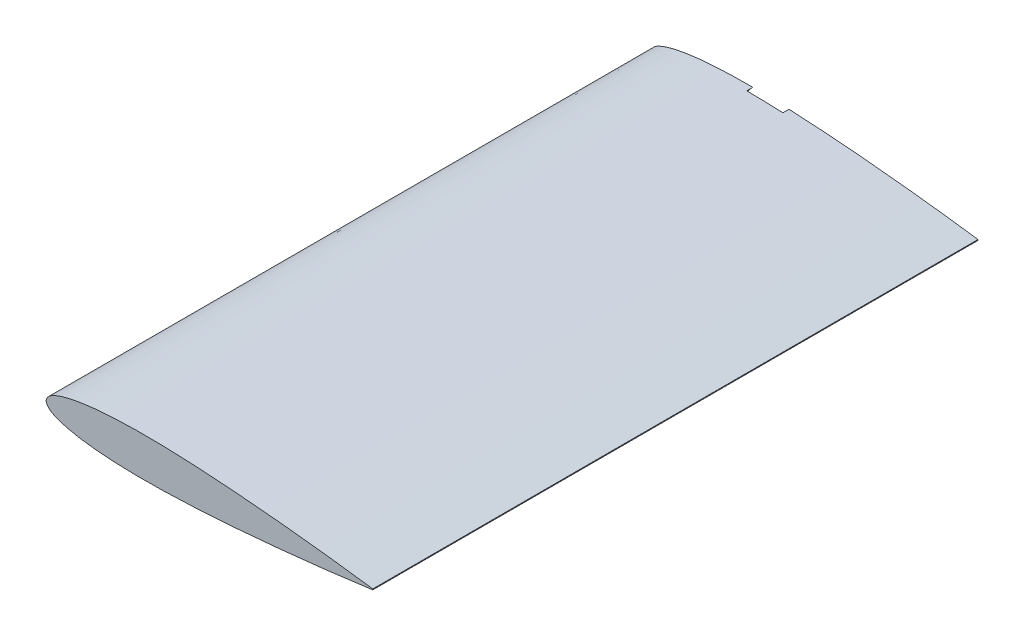
from build123d import *

# Parameters (mm, degrees)
BOSS_EXTRUDE1_DEPTH = 100
SHELL1_START        = 2
SHELL1_DEPTH        = 97
BOSS_EXTRUDE2_REACH = 115.695
SKETCH4_R           = 4.35
CUT_EXTRUDE1_DEPTH  = 1
SKETCH5_R           = 1
CUT_EXTRUDE2_DEPTH  = 2


# Read off the part's stored shape, not the designer's step: Shell1
with BuildPart() as part:
    # Sketch1 → Boss-Extrude1 (new body)
    with BuildSketch(Plane.XY):
        with BuildLine():
            add(Edge.make_bspline(
                [(0, 0), (0.096672882, -0.462214069), (0.351976089, -0.780117648), (0.675, -1.02276)],
                knots=[0, 0, 0, 0, 0.022277188, 0.022277188, 0.022277188, 0.022277188], degree=3))
            Line((0.675, -1.02276), (0.675, 1.02276))
            add(Edge.make_bspline(
                [(0, 0), (0.096672882, 0.462214069), (0.351976089, 0.780117648), (0.675, 1.02276)],
                knots=[0, 0, 0, 0, 0.022277188, 0.022277188, 0.022277188, 0.022277188], degree=3))
        make_face()
        with BuildLine():
            Line((0.675, 1.02276), (0.675, -1.02276))
            add(Edge.make_bspline(
                [(0.675, -1.02276), (0.880408359, -1.177054359), (1.113200179, -1.30091618), (1.35, -1.4121)],
                knots=[0.022277188, 0.022277188, 0.022277188, 0.022277188, 0.036443076, 0.036443076, 0.036443076, 0.036443076], degree=3))
            Line((1.35, -1.4121), (1.35, 1.4121))
            add(Edge.make_bspline(
                [(0.675, 1.02276), (0.880408359, 1.177054359), (1.113200179, 1.30091618), (1.35, 1.4121)],
                knots=[0.022277188, 0.022277188, 0.022277188, 0.022277188, 0.036443076, 0.036443076, 0.036443076, 0.036443076], degree=3))
        make_face()
        with BuildLine():
            Line((1.35, 1.4121), (1.35, -1.4121))
            add(Edge.make_bspline(
                [(1.35, -1.4121), (1.788288243, -1.617887999), (2.240306933, -1.780244213), (2.7, -1.9197)],
                knots=[0.036443076, 0.036443076, 0.036443076, 0.036443076, 0.062662446, 0.062662446, 0.062662446, 0.062662446], degree=3))
            Line((2.7, -1.9197), (2.7, 1.9197))
            add(Edge.make_bspline(
                [(1.35, 1.4121), (1.788288243, 1.617887999), (2.240306933, 1.780244213), (2.7, 1.9197)],
                knots=[0.036443076, 0.036443076, 0.036443076, 0.036443076, 0.062662446, 0.062662446, 0.062662446, 0.062662446], degree=3))
        make_face()
        with BuildLine():
            Line((2.7, 1.9197), (2.7, -1.9197))
            add(Edge.make_bspline(
                [(2.7, -1.9197), (3.144372368, -2.05450799), (3.595916093, -2.16791657), (4.05, -2.268)],
                knots=[0.062662446, 0.062662446, 0.062662446, 0.062662446, 0.088007975, 0.088007975, 0.088007975, 0.088007975], degree=3))
            Line((4.05, -2.268), (4.05, 2.268))
            add(Edge.make_bspline(
                [(2.7, 1.9197), (3.144372368, 2.05450799), (3.595916093, 2.16791657), (4.05, 2.268)],
                knots=[0.062662446, 0.062662446, 0.062662446, 0.062662446, 0.088007975, 0.088007975, 0.088007975, 0.088007975], degree=3))
        make_face()
        with BuildLine():
            Line((4.05, 2.268), (4.05, -2.268))
            add(Edge.make_bspline(
                [(4.05, -2.268), (4.497816748, -2.366702102), (4.948104044, -2.452444337), (5.4, -2.52882)],
                knots=[0.088007975, 0.088007975, 0.088007975, 0.088007975, 0.113003691, 0.113003691, 0.113003691, 0.113003691], degree=3))
            Line((5.4, -2.52882), (5.4, 2.52882))
            add(Edge.make_bspline(
                [(4.05, 2.268), (4.497816748, 2.366702102), (4.948104044, 2.452444337), (5.4, 2.52882)],
                knots=[0.088007975, 0.088007975, 0.088007975, 0.088007975, 0.113003691, 0.113003691, 0.113003691, 0.113003691], degree=3))
        make_face()
        with BuildLine():
            Line((5.4, 2.52882), (5.4, -2.52882))
            add(Edge.make_bspline(
                [(5.4, -2.52882), (6.295126323, -2.680106741), (7.196564485, -2.794642208), (8.1, -2.8863)],
                knots=[0.113003691, 0.113003691, 0.113003691, 0.113003691, 0.162515802, 0.162515802, 0.162515802, 0.162515802], degree=3))
            Line((8.1, -2.8863), (8.1, 2.8863))
            add(Edge.make_bspline(
                [(5.4, 2.52882), (6.295126323, 2.680106741), (7.196564485, 2.794642208), (8.1, 2.8863)],
                knots=[0.113003691, 0.113003691, 0.113003691, 0.113003691, 0.162515802, 0.162515802, 0.162515802, 0.162515802], degree=3))
        make_face()
        with BuildLine():
            Line((8.1, 2.8863), (8.1, -2.8863))
            add(Edge.make_bspline(
                [(8.1, -2.8863), (8.998367894, -2.977443658), (9.898710795, -3.045965575), (10.8, -3.09798)],
                knots=[0.162515802, 0.162515802, 0.162515802, 0.162515802, 0.211750186, 0.211750186, 0.211750186, 0.211750186], degree=3))
            Line((10.8, -3.09798), (10.8, 3.09798))
            add(Edge.make_bspline(
                [(8.1, 2.8863), (8.998367894, 2.977443658), (9.898710795, 3.045965575), (10.8, 3.09798)],
                knots=[0.162515802, 0.162515802, 0.162515802, 0.162515802, 0.211750186, 0.211750186, 0.211750186, 0.211750186], degree=3))
        make_face()
        with BuildLine():
            Line((10.8, 3.09798), (10.8, -3.09798))
            add(Edge.make_bspline(
                [(10.8, -3.09798), (11.69927955, -3.149878446), (12.599501187, -3.185342932), (13.5, -3.20814)],
                knots=[0.211750186, 0.211750186, 0.211750186, 0.211750186, 0.26087479, 0.26087479, 0.26087479, 0.26087479], degree=3))
            Line((13.5, -3.20814), (13.5, 3.20814))
            add(Edge.make_bspline(
                [(10.8, 3.09798), (11.69927955, 3.149878446), (12.599501187, 3.185342932), (13.5, 3.20814)],
                knots=[0.211750186, 0.211750186, 0.211750186, 0.211750186, 0.26087479, 0.26087479, 0.26087479, 0.26087479], degree=3))
        make_face()
        with BuildLine():
            Line((13.5, 3.20814), (13.5, -3.20814))
            add(Edge.make_bspline(
                [(13.5, -3.20814), (14.399817201, -3.230919812), (15.299911159, -3.241051374), (16.2, -3.24108)],
                knots=[0.26087479, 0.26087479, 0.26087479, 0.26087479, 0.30996221, 0.30996221, 0.30996221, 0.30996221], degree=3))
            Line((16.2, -3.24108), (16.2, 3.24108))
            add(Edge.make_bspline(
                [(13.5, 3.20814), (14.399817201, 3.230919812), (15.299911159, 3.241051374), (16.2, 3.24108)],
                knots=[0.26087479, 0.26087479, 0.26087479, 0.26087479, 0.30996221, 0.30996221, 0.30996221, 0.30996221], degree=3))
        make_face()
        with BuildLine():
            Line((16.2, 3.24108), (16.2, -3.24108))
            add(Edge.make_bspline(
                [(16.2, -3.24108), (18.000400111, -3.241137259), (19.800779751, -3.200772785), (21.6, -3.13362)],
                knots=[0.30996221, 0.30996221, 0.30996221, 0.30996221, 0.40814918, 0.40814918, 0.40814918, 0.40814918], degree=3))
            Line((21.6, -3.13362), (21.6, 3.13362))
            add(Edge.make_bspline(
                [(16.2, 3.24108), (18.000400111, 3.241137259), (19.800779751, 3.200772785), (21.6, 3.13362)],
                knots=[0.30996221, 0.30996221, 0.30996221, 0.30996221, 0.40814918, 0.40814918, 0.40814918, 0.40814918], degree=3))
        make_face()
        with BuildLine():
            Line((21.6, 3.13362), (21.6, -3.13362))
            add(Edge.make_bspline(
                [(21.6, -3.13362), (23.40119285, -3.066393591), (25.201223764, -2.972320097), (27, -2.85876)],
                knots=[0.40814918, 0.40814918, 0.40814918, 0.40814918, 0.506443799, 0.506443799, 0.506443799, 0.506443799], degree=3))
            Line((27, -2.85876), (27, 2.85876))
            add(Edge.make_bspline(
                [(21.6, 3.13362), (23.40119285, 3.066393591), (25.201223764, 2.972320097), (27, 2.85876)],
                knots=[0.40814918, 0.40814918, 0.40814918, 0.40814918, 0.506443799, 0.506443799, 0.506443799, 0.506443799], degree=3))
        make_face()
        with BuildLine():
            Line((27, 2.85876), (27, -2.85876))
            add(Edge.make_bspline(
                [(27, -2.85876), (28.801243981, -2.745044109), (30.601229838, -2.611788111), (32.4, -2.46402)],
                knots=[0.506443799, 0.506443799, 0.506443799, 0.506443799, 0.604873268, 0.604873268, 0.604873268, 0.604873268], degree=3))
            Line((32.4, -2.46402), (32.4, 2.46402))
            add(Edge.make_bspline(
                [(27, 2.85876), (28.801243981, 2.745044109), (30.601229838, 2.611788111), (32.4, 2.46402)],
                knots=[0.506443799, 0.506443799, 0.506443799, 0.506443799, 0.604873268, 0.604873268, 0.604873268, 0.604873268], degree=3))
        make_face()
        with BuildLine():
            Line((32.4, 2.46402), (32.4, -2.46402))
            add(Edge.make_bspline(
                [(32.4, -2.46402), (34.201218281, -2.316050778), (36.001217555, -2.153529914), (37.8, -1.97856)],
                knots=[0.604873268, 0.604873268, 0.604873268, 0.604873268, 0.7034367, 0.7034367, 0.7034367, 0.7034367], degree=3))
            Line((37.8, -1.97856), (37.8, 1.97856))
            add(Edge.make_bspline(
                [(32.4, 2.46402), (34.201218281, 2.316050778), (36.001217555, 2.153529914), (37.8, 1.97856)],
                knots=[0.604873268, 0.604873268, 0.604873268, 0.604873268, 0.7034367, 0.7034367, 0.7034367, 0.7034367], degree=3))
        make_face()
        with BuildLine():
            Line((37.8, 1.97856), (37.8, -1.97856))
            add(Edge.make_bspline(
                [(37.8, -1.97856), (39.601238547, -1.803351177), (41.401256939, -1.615659284), (43.2, -1.41642)],
                knots=[0.7034367, 0.7034367, 0.7034367, 0.7034367, 0.802134713, 0.802134713, 0.802134713, 0.802134713], degree=3))
            Line((43.2, -1.41642), (43.2, 1.41642))
            add(Edge.make_bspline(
                [(37.8, 1.97856), (39.601238547, 1.803351177), (41.401256939, 1.615659284), (43.2, 1.41642)],
                knots=[0.7034367, 0.7034367, 0.7034367, 0.7034367, 0.802134713, 0.802134713, 0.802134713, 0.802134713], degree=3))
        make_face()
        with BuildLine():
            Line((43.2, 1.41642), (43.2, -1.41642))
            add(Edge.make_bspline(
                [(43.2, -1.41642), (45.001383122, -1.216888288), (46.801487166, -1.005775264), (48.6, -0.78192)],
                knots=[0.802134713, 0.802134713, 0.802134713, 0.802134713, 0.900977587, 0.900977587, 0.900977587, 0.900977587], degree=3))
            Line((48.6, -0.78192), (48.6, 0.78192))
            add(Edge.make_bspline(
                [(43.2, 1.41642), (45.001383122, 1.216888288), (46.801487166, 1.005775264), (48.6, 0.78192)],
                knots=[0.802134713, 0.802134713, 0.802134713, 0.802134713, 0.900977587, 0.900977587, 0.900977587, 0.900977587], degree=3))
        make_face()
        with BuildLine():
            Line((48.6, 0.78192), (48.6, -0.78192))
            add(Edge.make_bspline(
                [(48.6, -0.78192), (49.500421632, -0.669847337), (50.40044443, -0.554580854), (51.3, -0.43578)],
                knots=[0.900977587, 0.900977587, 0.900977587, 0.900977587, 0.950463062, 0.950463062, 0.950463062, 0.950463062], degree=3))
            Line((51.3, -0.43578), (51.3, 0.43578))
            add(Edge.make_bspline(
                [(48.6, 0.78192), (49.500421632, 0.669847337), (50.40044443, 0.554580854), (51.3, 0.43578)],
                knots=[0.900977587, 0.900977587, 0.900977587, 0.900977587, 0.950463062, 0.950463062, 0.950463062, 0.950463062], degree=3))
        make_face()
        with BuildLine():
            Line((51.3, 0.43578), (51.3, -0.43578))
            add(Edge.make_bspline(
                [(51.3, -0.43578), (52.20049107, -0.316855598), (53.100513939, -0.194389469), (54, -0.06804)],
                knots=[0.950463062, 0.950463062, 0.950463062, 0.950463062, 1, 1, 1, 1], degree=3))
            Line((54, -0.06804), (54, 0.06804))
            add(Edge.make_bspline(
                [(51.3, 0.43578), (52.20049107, 0.316855598), (53.100513939, 0.194389469), (54, 0.06804)],
                knots=[0.950463062, 0.950463062, 0.950463062, 0.950463062, 1, 1, 1, 1], degree=3))
        make_face()
    extrude(amount=BOSS_EXTRUDE1_DEPTH)

    # Shell1 outline → Shell1 (cut)
    with BuildSketch(Plane.XY.offset(SHELL1_START)):
        with BuildLine():
            add(Edge.make_bspline(
                [(1.058623393, -1.49e-07), (1.075119993, 0.026392925), (1.093403251, 0.052230133), (1.113862389, 0.078124886), (1.136946081, 0.104517594), (1.163096513, 0.131656613), (1.192683699, 0.159615721), (1.2259605, 0.188343386), (1.263051431, 0.217722124), (1.303973016, 0.247616825), (1.348668278, 0.277901714), (1.397031118, 0.30846942), (1.448906083, 0.339235108), (1.504083532, 0.370146527), (1.57297173, 0.406831513), (1.583668628, 0.412477493), (1.594467107, 0.418127689), (1.60536592, 0.423782035), (1.616363814, 0.429440498), (1.627459529, 0.435103082), (1.638651799, 0.440769829), (1.649939349, 0.446440815), (1.661320899, 0.452116152), (1.672795161, 0.457795992), (1.68436084, 0.463480518), (1.696016635, 0.469169954), (1.707761237, 0.474864556), (1.725509377, 0.483414653), (1.73144132, 0.48626322), (1.73745685, 0.489142444), (1.743175633, 0.491872725), (1.749976725, 0.495105316), (1.754281882, 0.497152181), (1.763030108, 0.501284372), (1.765986685, 0.502681966), (1.774608877, 0.506735407), (1.779348443, 0.508957787), (1.785937076, 0.512039473), (1.791938156, 0.514837955), (1.7980622, 0.517686104), (1.810295561, 0.523359768), (1.816416468, 0.526190702), (1.822541603, 0.529015756), (1.828670967, 0.53183495), (1.834804563, 0.5346483), (1.840942391, 0.537455826), (1.847084454, 0.540257546), (1.853230753, 0.543053477), (1.85938129, 0.545843637), (1.865536067, 0.548628046), (1.871695086, 0.551406721), (1.877858347, 0.554179681), (1.884025853, 0.556946943), (1.914884615, 0.570754857), (1.939639723, 0.581710358), (1.964462932, 0.59257616), (1.989354244, 0.603353395), (2.014313664, 0.614043193), (2.039341193, 0.624646686), (2.064436835, 0.635165005), (2.089600591, 0.64559928), (2.114832466, 0.655950643), (2.140132462, 0.666220225), (2.165500582, 0.676409157), (2.190936828, 0.68651857), (2.216441204, 0.696549596), (2.29315873, 0.726410903), (2.34457574, 0.746009416), (2.396264015, 0.765307729), (2.448222652, 0.784314723), (2.500450577, 0.803039327), (2.55294654, 0.821490521), (2.605709121, 0.839677337), (2.658736724, 0.857608859), (2.712027583, 0.875294219), (2.765579755, 0.892742604), (2.819391129, 0.90996325), (2.873459416, 0.926965442), (2.927782157, 0.943758521), (3.03693128, 0.976945228), (3.091732893, 0.993331834), (3.146524962, 1.009445692), (3.201755781, 1.025425728), (3.256871468, 1.041111135), (3.312231726, 1.056614371), (3.36785696, 1.071946468), (3.423478822, 1.087032126), (3.47925215, 1.101922629), (3.535305819, 1.11666154), (3.59133897, 1.131163939), (3.647600482, 1.14550933), (3.70396528, 1.159665426), (3.788714108, 1.180637312), (3.816996256, 1.187583891), (3.845310574, 1.194486963), (3.873656697, 1.201347074), (3.902034256, 1.208164767), (3.930442886, 1.214940587), (3.958882219, 1.221675077), (3.987351888, 1.228368781), (4.015851527, 1.235022244), (4.044380768, 1.24163601), (4.072939244, 1.248210623), (4.101526589, 1.254746626), (4.130142435, 1.261244565), (4.187430397, 1.274165401), (4.216105022, 1.280588761), (4.244798484, 1.286973998), (4.27351158, 1.293318736), (4.302335934, 1.299649619), (4.331065909, 1.305917526), (4.359792173, 1.312141863), (4.38864479, 1.318354481), (4.417472305, 1.324521299), (4.446231056, 1.330631326), (4.47512956, 1.336733199), (4.503964458, 1.342780781), (4.532841629, 1.348798319), (4.619507402, 1.366740803), (4.677346297, 1.378559162), (4.735246406, 1.390236382), (4.793207226, 1.401774623), (4.85122826, 1.413176042), (4.909309005, 1.424442797), (4.967448962, 1.435577048), (5.02564763, 1.446580951), (5.083904509, 1.457456666), (5.142219099, 1.468206351), (5.200590899, 1.478832163), (5.259019409, 1.489336262), (5.317504129, 1.499720806), (5.434584986, 1.5202551), (5.49318391, 1.530405039), (5.551830738, 1.540441385), (5.610482155, 1.550345725), (5.669497507, 1.560213093), (5.727908623, 1.569839604), (5.786895052, 1.579452162), (5.845910272, 1.588959308), (5.904455383, 1.598259955), (5.963671326, 1.607568579), (6.02248308, 1.616691129), (6.081520377, 1.62574114), (6.140542117, 1.634677268), (6.317727829, 1.661176683), (6.435987683, 1.678426732), (6.554380721, 1.695269327), (6.672904067, 1.711713264), (6.791554838, 1.727767356), (6.910330136, 1.743440436), (7.029227055, 1.758741359), (7.148242674, 1.773678994), (7.267374065, 1.788262234), (7.386618285, 1.802499989), (7.505972383, 1.816401189), (7.625433395, 1.829974783), (7.744998345, 1.84322974), (7.924497198, 1.862647701), (7.984355312, 1.869043157), (8.044233573, 1.875360317), (8.104171789, 1.881610459), (8.164030483, 1.88776925), (8.22404363, 1.893871722), (8.284080406, 1.899906488), (8.343982991, 1.905850505), (8.403961565, 1.911727738), (8.46406653, 1.917548241), (8.524015342, 1.923278622), (8.584085277, 1.928950256), (8.644132594, 1.934548335), (8.764264457, 1.945606953), (8.824343709, 1.951066953), (8.884436194, 1.956458155), (8.944541827, 1.961781067), (9.004660521, 1.9670362), (9.064792191, 1.972224064), (9.124936751, 1.977345168), (9.185094114, 1.982400022), (9.245264196, 1.987389137), (9.305446909, 1.992313022), (9.365642168, 1.997172187), (9.425849886, 2.001967142), (9.486069979, 2.006698396), (9.66676712, 2.020702588), (9.787283846, 2.029786311), (9.907832434, 2.03861941), (10.028469135, 2.047212429), (10.14910818, 2.055560523), (10.269796661, 2.063671854), (10.390573439, 2.071555339), (10.511376429, 2.079209829), (10.632176506, 2.08663528), (10.753057648, 2.09384268), (10.87403846, 2.100840591), (10.994966282, 2.107621428), (11.115957702, 2.114191959), (11.357990321, 2.126916423), (11.479036518, 2.133070315), (11.600112134, 2.139018434), (11.721216704, 2.144763347), (11.84234976, 2.15030762), (11.963510835, 2.155653819), (12.084699462, 2.160804511), (12.205915176, 2.165762263), (12.327157507, 2.170529641), (12.448425991, 2.175109212), (12.56972016, 2.179503542), (12.691039546, 2.183715198), (12.812383684, 2.187746747), (13.17648895, 2.199308769), (13.419336971, 2.206307783), (13.662151809, 2.21261052), (13.90555308, 2.218256823), (14.14802945, 2.223266915), (14.39159215, 2.227588019), (14.634723768, 2.231322043), (14.877682103, 2.234445049), (15.121352512, 2.236930967), (15.364440983, 2.238874391), (15.607982066, 2.240223424), (15.851391798, 2.241021109), (16.094925031, 2.241277984), (16.58203171, 2.240730609), (16.825618123, 2.239926008), (17.069236802, 2.238599939), (17.312886938, 2.236761851), (17.556567721, 2.234421191), (17.800278342, 2.231587406), (18.044017993, 2.228269943), (18.287785864, 2.224478249), (18.531581147, 2.220221773), (18.775403033, 2.215509961), (19.019250713, 2.210352261), (19.263123377, 2.20475812), (19.507020217, 2.198736985), (19.994860631, 2.185859623), (20.238805473, 2.179004782), (20.482752748, 2.171729339), (20.726861332, 2.164113132), (20.970405936, 2.155940734), (21.215624607, 2.147718892), (21.457555521, 2.138675524), (21.704227807, 2.129681754), (21.946172694, 2.120119672), (22.191416211, 2.110263548), (22.435048408, 2.100072196), (22.679225264, 2.089531478), (22.923289464, 2.078661831), (23.411446293, 2.056266084), (23.655527019, 2.044740493), (23.899609988, 2.032892311), (24.143695131, 2.020726665), (24.38778238, 2.008248682), (24.631871666, 1.995463489), (24.875962921, 1.982376214), (25.120056075, 1.968991982), (25.36415106, 1.955315921), (25.608247809, 1.941353158), (25.852346251, 1.92710882), (26.096446318, 1.912588034), (26.340547942, 1.897795927), (27.072857279, 1.852621022), (27.561071121, 1.821436457), (28.049325362, 1.78925686), (28.537179213, 1.755995133), (29.026156978, 1.721960251), (29.51273273, 1.686589264), (30.003143584, 1.650914714), (30.488582438, 1.613624441), (30.979110148, 1.576117094), (31.465481489, 1.537389818), (31.954359846, 1.497981818), (32.442196855, 1.457818926), (32.9302142, 1.416882621), (33.906114424, 1.333517477), (34.394026178, 1.291086931), (34.88184581, 1.247917111), (35.36981558, 1.204027851), (35.857266495, 1.159425909), (36.34540994, 1.114091715), (36.832863233, 1.068138726), (37.320329013, 1.021443458), (37.808389315, 0.974050715), (38.295569992, 0.92614555), (38.783218731, 0.87745378), (39.27061148, 0.828182103), (39.757992592, 0.778250756), (40.48897205, 0.702403029), (40.732618716, 0.676961366), (40.97624855, 0.6513615), (41.219864801, 0.625603805), (41.463468788, 0.599688888), (41.707058929, 0.573617573), (41.950633053, 0.54739064), (42.194190769, 0.521008656), (42.437734039, 0.494472026), (42.681265487, 0.467781275), (42.924785305, 0.440937328), (43.168289057, 0.41394144), (43.411769993, 0.386794205), (43.876710356, 0.334656613), (44.098173179, 0.309693206), (44.319619193, 0.284602107), (44.541048237, 0.259382712), (44.762460148, 0.23403442), (44.983854763, 0.208556629), (45.205231918, 0.182948734), (45.426591453, 0.157210135), (45.647933203, 0.131340229), (45.869257006, 0.105338412), (46.0905627, 0.079204084), (46.311850121, 0.052936641), (46.533119106, 0.02653548), (46.754369494, 0)],
                knots=[0.009755785, 0.009755785, 0.009755785, 0.009755785, 0.009755785, 0.009755785, 0.009755785, 0.009755785, 0.009755785, 0.009755785, 0.009755785, 0.009755785, 0.009755785, 0.009755785, 0.009755785, 0.03125, 0.03125, 0.03125, 0.03125, 0.03125, 0.03125, 0.03125, 0.03125, 0.03125, 0.03125, 0.03125, 0.03125, 0.03125, 0.03515625, 0.03515625, 0.03515625, 0.03515625, 0.03515625, 0.03515625, 0.03515625, 0.03515625, 0.03515625, 0.03515625, 0.03515625, 0.03515625, 0.03515625, 0.037109375, 0.037109375, 0.037109375, 0.037109375, 0.037109375, 0.037109375, 0.037109375, 0.037109375, 0.037109375, 0.037109375, 0.037109375, 0.037109375, 0.037109375, 0.0390625, 0.0390625, 0.0390625, 0.0390625, 0.0390625, 0.0390625, 0.0390625, 0.0390625, 0.0390625, 0.0390625, 0.0390625, 0.0390625, 0.0390625, 0.046875, 0.046875, 0.046875, 0.046875, 0.046875, 0.046875, 0.046875, 0.046875, 0.046875, 0.046875, 0.046875, 0.046875, 0.046875, 0.0625, 0.0625, 0.0625, 0.0625, 0.0625, 0.0625, 0.0625, 0.0625, 0.0625, 0.0625, 0.0625, 0.0625, 0.0625, 0.078125, 0.078125, 0.078125, 0.078125, 0.078125, 0.078125, 0.078125, 0.078125, 0.078125, 0.078125, 0.078125, 0.078125, 0.078125, 0.0859375, 0.0859375, 0.0859375, 0.0859375, 0.0859375, 0.0859375, 0.0859375, 0.0859375, 0.0859375, 0.0859375, 0.0859375, 0.0859375, 0.0859375, 0.09375, 0.09375, 0.09375, 0.09375, 0.09375, 0.09375, 0.09375, 0.09375, 0.09375, 0.09375, 0.09375, 0.09375, 0.09375, 0.109375, 0.109375, 0.109375, 0.109375, 0.109375, 0.109375, 0.109375, 0.109375, 0.109375, 0.109375, 0.109375, 0.109375, 0.109375, 0.125, 0.125, 0.125, 0.125, 0.125, 0.125, 0.125, 0.125, 0.125, 0.125, 0.125, 0.125, 0.125, 0.15625, 0.15625, 0.15625, 0.15625, 0.15625, 0.15625, 0.15625, 0.15625, 0.15625, 0.15625, 0.15625, 0.15625, 0.15625, 0.171875, 0.171875, 0.171875, 0.171875, 0.171875, 0.171875, 0.171875, 0.171875, 0.171875, 0.171875, 0.171875, 0.171875, 0.171875, 0.1875, 0.1875, 0.1875, 0.1875, 0.1875, 0.1875, 0.1875, 0.1875, 0.1875, 0.1875, 0.1875, 0.1875, 0.1875, 0.21875, 0.21875, 0.21875, 0.21875, 0.21875, 0.21875, 0.21875, 0.21875, 0.21875, 0.21875, 0.21875, 0.21875, 0.21875, 0.25, 0.25, 0.25, 0.25, 0.25, 0.25, 0.25, 0.25, 0.25, 0.25, 0.25, 0.25, 0.25, 0.3125, 0.3125, 0.3125, 0.3125, 0.3125, 0.3125, 0.3125, 0.3125, 0.3125, 0.3125, 0.3125, 0.3125, 0.3125, 0.375, 0.375, 0.375, 0.375, 0.375, 0.375, 0.375, 0.375, 0.375, 0.375, 0.375, 0.375, 0.375, 0.4375, 0.4375, 0.4375, 0.4375, 0.4375, 0.4375, 0.4375, 0.4375, 0.4375, 0.4375, 0.4375, 0.4375, 0.4375, 0.5, 0.5, 0.5, 0.5, 0.5, 0.5, 0.5, 0.5, 0.5, 0.5, 0.5, 0.5, 0.5, 0.625, 0.625, 0.625, 0.625, 0.625, 0.625, 0.625, 0.625, 0.625, 0.625, 0.625, 0.625, 0.625, 0.75, 0.75, 0.75, 0.75, 0.75, 0.75, 0.75, 0.75, 0.75, 0.75, 0.75, 0.75, 0.75, 0.8125, 0.8125, 0.8125, 0.8125, 0.8125, 0.8125, 0.8125, 0.8125, 0.8125, 0.8125, 0.8125, 0.8125, 0.8125, 0.869357044, 0.869357044, 0.869357044, 0.869357044, 0.869357044, 0.869357044, 0.869357044, 0.869357044, 0.869357044, 0.869357044, 0.869357044, 0.869357044, 0.869357044, 0.869357044, 0.869357044], degree=14))
            add(Edge.make_bspline(
                [(1.058623393, -1.49e-07), (1.075119993, -0.026392925), (1.093403251, -0.052230133), (1.113862389, -0.078124886), (1.136946081, -0.104517594), (1.163096513, -0.131656613), (1.192683699, -0.159615721), (1.2259605, -0.188343386), (1.263051431, -0.217722124), (1.303973016, -0.247616825), (1.348668278, -0.277901714), (1.397031118, -0.30846942), (1.448906083, -0.339235108), (1.504083532, -0.370146527), (1.57297173, -0.406831513), (1.583668628, -0.412477493), (1.594467107, -0.418127689), (1.60536592, -0.423782035), (1.616363814, -0.429440498), (1.627459529, -0.435103082), (1.638651799, -0.440769829), (1.649939349, -0.446440815), (1.661320899, -0.452116152), (1.672795161, -0.457795992), (1.68436084, -0.463480518), (1.696016635, -0.469169954), (1.707761237, -0.474864556), (1.725509377, -0.483414653), (1.73144132, -0.48626322), (1.73745685, -0.489142444), (1.743175633, -0.491872725), (1.749976725, -0.495105316), (1.754281882, -0.497152181), (1.763030108, -0.501284372), (1.765986685, -0.502681966), (1.774608877, -0.506735407), (1.779348443, -0.508957787), (1.785937076, -0.512039473), (1.791938156, -0.514837955), (1.7980622, -0.517686104), (1.810295561, -0.523359768), (1.816416468, -0.526190702), (1.822541603, -0.529015756), (1.828670967, -0.53183495), (1.834804563, -0.5346483), (1.840942391, -0.537455826), (1.847084454, -0.540257546), (1.853230753, -0.543053477), (1.85938129, -0.545843637), (1.865536067, -0.548628046), (1.871695086, -0.551406721), (1.877858347, -0.554179681), (1.884025853, -0.556946943), (1.914884615, -0.570754857), (1.939639723, -0.581710358), (1.964462932, -0.59257616), (1.989354244, -0.603353395), (2.014313664, -0.614043193), (2.039341193, -0.624646686), (2.064436835, -0.635165005), (2.089600591, -0.64559928), (2.114832466, -0.655950643), (2.140132462, -0.666220225), (2.165500582, -0.676409157), (2.190936828, -0.68651857), (2.216441204, -0.696549596), (2.29315873, -0.726410903), (2.34457574, -0.746009416), (2.396264015, -0.765307729), (2.448222652, -0.784314723), (2.500450577, -0.803039327), (2.55294654, -0.821490521), (2.605709121, -0.839677337), (2.658736724, -0.857608859), (2.712027583, -0.875294219), (2.765579755, -0.892742604), (2.819391129, -0.90996325), (2.873459416, -0.926965442), (2.927782157, -0.943758521), (3.03693128, -0.976945228), (3.091732893, -0.993331834), (3.146524962, -1.009445692), (3.201755781, -1.025425728), (3.256871468, -1.041111135), (3.312231726, -1.056614371), (3.36785696, -1.071946468), (3.423478822, -1.087032126), (3.47925215, -1.101922629), (3.535305819, -1.11666154), (3.59133897, -1.131163939), (3.647600482, -1.14550933), (3.70396528, -1.159665426), (3.788714108, -1.180637312), (3.816996256, -1.187583891), (3.845310574, -1.194486963), (3.873656697, -1.201347074), (3.902034256, -1.208164767), (3.930442886, -1.214940587), (3.958882219, -1.221675077), (3.987351888, -1.228368781), (4.015851527, -1.235022244), (4.044380768, -1.24163601), (4.072939244, -1.248210623), (4.101526589, -1.254746626), (4.130142435, -1.261244565), (4.187430397, -1.274165401), (4.216105022, -1.280588761), (4.244798484, -1.286973998), (4.27351158, -1.293318736), (4.302335934, -1.299649619), (4.331065909, -1.305917526), (4.359792173, -1.312141863), (4.38864479, -1.318354481), (4.417472305, -1.324521299), (4.446231056, -1.330631326), (4.47512956, -1.336733199), (4.503964458, -1.342780781), (4.532841629, -1.348798319), (4.619507402, -1.366740803), (4.677346297, -1.378559162), (4.735246406, -1.390236382), (4.793207226, -1.401774623), (4.85122826, -1.413176042), (4.909309005, -1.424442797), (4.967448962, -1.435577048), (5.02564763, -1.446580951), (5.083904509, -1.457456666), (5.142219099, -1.468206351), (5.200590899, -1.478832163), (5.259019409, -1.489336262), (5.317504129, -1.499720806), (5.434584986, -1.5202551), (5.49318391, -1.530405039), (5.551830738, -1.540441385), (5.610482155, -1.550345725), (5.669497507, -1.560213093), (5.727908623, -1.569839604), (5.786895052, -1.579452162), (5.845910272, -1.588959308), (5.904455383, -1.598259955), (5.963671326, -1.607568579), (6.02248308, -1.616691129), (6.081520377, -1.62574114), (6.140542117, -1.634677268), (6.317727829, -1.661176683), (6.435987683, -1.678426732), (6.554380721, -1.695269327), (6.672904067, -1.711713264), (6.791554838, -1.727767356), (6.910330136, -1.743440436), (7.029227055, -1.758741359), (7.148242674, -1.773678994), (7.267374065, -1.788262234), (7.386618285, -1.802499989), (7.505972383, -1.816401189), (7.625433395, -1.829974783), (7.744998345, -1.84322974), (7.924497198, -1.862647701), (7.984355312, -1.869043157), (8.044233573, -1.875360317), (8.104171789, -1.881610459), (8.164030483, -1.88776925), (8.22404363, -1.893871722), (8.284080406, -1.899906488), (8.343982991, -1.905850505), (8.403961565, -1.911727738), (8.46406653, -1.917548241), (8.524015342, -1.923278622), (8.584085277, -1.928950256), (8.644132594, -1.934548335), (8.764264457, -1.945606953), (8.824343709, -1.951066953), (8.884436194, -1.956458155), (8.944541827, -1.961781067), (9.004660521, -1.9670362), (9.064792191, -1.972224064), (9.124936751, -1.977345168), (9.185094114, -1.982400022), (9.245264196, -1.987389137), (9.305446909, -1.992313022), (9.365642168, -1.997172187), (9.425849886, -2.001967142), (9.486069979, -2.006698396), (9.66676712, -2.020702588), (9.787283846, -2.029786311), (9.907832434, -2.03861941), (10.028469135, -2.047212429), (10.14910818, -2.055560523), (10.269796661, -2.063671854), (10.390573439, -2.071555339), (10.511376429, -2.079209829), (10.632176506, -2.08663528), (10.753057648, -2.09384268), (10.87403846, -2.100840591), (10.994966282, -2.107621428), (11.115957702, -2.114191959), (11.357990321, -2.126916423), (11.479036518, -2.133070315), (11.600112134, -2.139018434), (11.721216704, -2.144763347), (11.84234976, -2.15030762), (11.963510835, -2.155653819), (12.084699462, -2.160804511), (12.205915176, -2.165762263), (12.327157507, -2.170529641), (12.448425991, -2.175109212), (12.56972016, -2.179503542), (12.691039546, -2.183715198), (12.812383684, -2.187746747), (13.17648895, -2.199308769), (13.419336971, -2.206307783), (13.662151809, -2.21261052), (13.90555308, -2.218256823), (14.14802945, -2.223266915), (14.39159215, -2.227588019), (14.634723768, -2.231322043), (14.877682103, -2.234445049), (15.121352512, -2.236930967), (15.364440983, -2.238874391), (15.607982066, -2.240223424), (15.851391798, -2.241021109), (16.094925031, -2.241277984), (16.58203171, -2.240730609), (16.825618123, -2.239926008), (17.069236802, -2.238599939), (17.312886938, -2.236761851), (17.556567721, -2.234421191), (17.800278342, -2.231587406), (18.044017993, -2.228269943), (18.287785864, -2.224478249), (18.531581147, -2.220221773), (18.775403033, -2.215509961), (19.019250713, -2.210352261), (19.263123377, -2.20475812), (19.507020217, -2.198736985), (19.994860631, -2.185859623), (20.238805473, -2.179004782), (20.482752748, -2.171729339), (20.726861332, -2.164113132), (20.970405936, -2.155940734), (21.215624607, -2.147718892), (21.457555521, -2.138675524), (21.704227807, -2.129681754), (21.946172694, -2.120119672), (22.191416211, -2.110263548), (22.435048408, -2.100072196), (22.679225264, -2.089531478), (22.923289464, -2.078661831), (23.411446293, -2.056266084), (23.655527019, -2.044740493), (23.899609988, -2.032892311), (24.143695131, -2.020726665), (24.38778238, -2.008248682), (24.631871666, -1.995463489), (24.875962921, -1.982376214), (25.120056075, -1.968991982), (25.36415106, -1.955315921), (25.608247809, -1.941353158), (25.852346251, -1.92710882), (26.096446318, -1.912588034), (26.340547942, -1.897795927), (27.072857279, -1.852621022), (27.561071121, -1.821436457), (28.049325362, -1.78925686), (28.537179213, -1.755995133), (29.026156978, -1.721960251), (29.51273273, -1.686589264), (30.003143584, -1.650914714), (30.488582438, -1.613624441), (30.979110148, -1.576117094), (31.465481489, -1.537389818), (31.954359846, -1.497981818), (32.442196855, -1.457818926), (32.9302142, -1.416882621), (33.906114424, -1.333517477), (34.394026178, -1.291086931), (34.88184581, -1.247917111), (35.36981558, -1.204027851), (35.857266495, -1.159425909), (36.34540994, -1.114091715), (36.832863233, -1.068138726), (37.320329013, -1.021443458), (37.808389315, -0.974050715), (38.295569992, -0.92614555), (38.783218731, -0.87745378), (39.27061148, -0.828182103), (39.757992592, -0.778250756), (40.48897205, -0.702403029), (40.732618716, -0.676961366), (40.97624855, -0.6513615), (41.219864801, -0.625603805), (41.463468788, -0.599688888), (41.707058929, -0.573617573), (41.950633053, -0.54739064), (42.194190769, -0.521008656), (42.437734039, -0.494472026), (42.681265487, -0.467781275), (42.924785305, -0.440937328), (43.168289057, -0.41394144), (43.411769993, -0.386794205), (43.876710356, -0.334656613), (44.098173179, -0.309693206), (44.319619193, -0.284602107), (44.541048237, -0.259382712), (44.762460148, -0.23403442), (44.983854763, -0.208556629), (45.205231918, -0.182948734), (45.426591453, -0.157210135), (45.647933203, -0.131340229), (45.869257006, -0.105338412), (46.0905627, -0.079204084), (46.311850121, -0.052936641), (46.533119106, -0.02653548), (46.754369494, 0)],
                knots=[0.009755785, 0.009755785, 0.009755785, 0.009755785, 0.009755785, 0.009755785, 0.009755785, 0.009755785, 0.009755785, 0.009755785, 0.009755785, 0.009755785, 0.009755785, 0.009755785, 0.009755785, 0.03125, 0.03125, 0.03125, 0.03125, 0.03125, 0.03125, 0.03125, 0.03125, 0.03125, 0.03125, 0.03125, 0.03125, 0.03125, 0.03515625, 0.03515625, 0.03515625, 0.03515625, 0.03515625, 0.03515625, 0.03515625, 0.03515625, 0.03515625, 0.03515625, 0.03515625, 0.03515625, 0.03515625, 0.037109375, 0.037109375, 0.037109375, 0.037109375, 0.037109375, 0.037109375, 0.037109375, 0.037109375, 0.037109375, 0.037109375, 0.037109375, 0.037109375, 0.037109375, 0.0390625, 0.0390625, 0.0390625, 0.0390625, 0.0390625, 0.0390625, 0.0390625, 0.0390625, 0.0390625, 0.0390625, 0.0390625, 0.0390625, 0.0390625, 0.046875, 0.046875, 0.046875, 0.046875, 0.046875, 0.046875, 0.046875, 0.046875, 0.046875, 0.046875, 0.046875, 0.046875, 0.046875, 0.0625, 0.0625, 0.0625, 0.0625, 0.0625, 0.0625, 0.0625, 0.0625, 0.0625, 0.0625, 0.0625, 0.0625, 0.0625, 0.078125, 0.078125, 0.078125, 0.078125, 0.078125, 0.078125, 0.078125, 0.078125, 0.078125, 0.078125, 0.078125, 0.078125, 0.078125, 0.0859375, 0.0859375, 0.0859375, 0.0859375, 0.0859375, 0.0859375, 0.0859375, 0.0859375, 0.0859375, 0.0859375, 0.0859375, 0.0859375, 0.0859375, 0.09375, 0.09375, 0.09375, 0.09375, 0.09375, 0.09375, 0.09375, 0.09375, 0.09375, 0.09375, 0.09375, 0.09375, 0.09375, 0.109375, 0.109375, 0.109375, 0.109375, 0.109375, 0.109375, 0.109375, 0.109375, 0.109375, 0.109375, 0.109375, 0.109375, 0.109375, 0.125, 0.125, 0.125, 0.125, 0.125, 0.125, 0.125, 0.125, 0.125, 0.125, 0.125, 0.125, 0.125, 0.15625, 0.15625, 0.15625, 0.15625, 0.15625, 0.15625, 0.15625, 0.15625, 0.15625, 0.15625, 0.15625, 0.15625, 0.15625, 0.171875, 0.171875, 0.171875, 0.171875, 0.171875, 0.171875, 0.171875, 0.171875, 0.171875, 0.171875, 0.171875, 0.171875, 0.171875, 0.1875, 0.1875, 0.1875, 0.1875, 0.1875, 0.1875, 0.1875, 0.1875, 0.1875, 0.1875, 0.1875, 0.1875, 0.1875, 0.21875, 0.21875, 0.21875, 0.21875, 0.21875, 0.21875, 0.21875, 0.21875, 0.21875, 0.21875, 0.21875, 0.21875, 0.21875, 0.25, 0.25, 0.25, 0.25, 0.25, 0.25, 0.25, 0.25, 0.25, 0.25, 0.25, 0.25, 0.25, 0.3125, 0.3125, 0.3125, 0.3125, 0.3125, 0.3125, 0.3125, 0.3125, 0.3125, 0.3125, 0.3125, 0.3125, 0.3125, 0.375, 0.375, 0.375, 0.375, 0.375, 0.375, 0.375, 0.375, 0.375, 0.375, 0.375, 0.375, 0.375, 0.4375, 0.4375, 0.4375, 0.4375, 0.4375, 0.4375, 0.4375, 0.4375, 0.4375, 0.4375, 0.4375, 0.4375, 0.4375, 0.5, 0.5, 0.5, 0.5, 0.5, 0.5, 0.5, 0.5, 0.5, 0.5, 0.5, 0.5, 0.5, 0.625, 0.625, 0.625, 0.625, 0.625, 0.625, 0.625, 0.625, 0.625, 0.625, 0.625, 0.625, 0.625, 0.75, 0.75, 0.75, 0.75, 0.75, 0.75, 0.75, 0.75, 0.75, 0.75, 0.75, 0.75, 0.75, 0.8125, 0.8125, 0.8125, 0.8125, 0.8125, 0.8125, 0.8125, 0.8125, 0.8125, 0.8125, 0.8125, 0.8125, 0.8125, 0.869357044, 0.869357044, 0.869357044, 0.869357044, 0.869357044, 0.869357044, 0.869357044, 0.869357044, 0.869357044, 0.869357044, 0.869357044, 0.869357044, 0.869357044, 0.869357044, 0.869357044], degree=14))
        make_face()
    extrude(amount=SHELL1_DEPTH, mode=Mode.SUBTRACT)

    # Sketch2 → Boss-Extrude2 (add, up to next)
    with BuildSketch(Plane(origin=(0, 0, 0), x_dir=(-1, 0, 0), z_dir=(0, 0, -1)), mode=Mode.PRIVATE) as boss_extrude2_sk1:
        Polygon((-18.686115585, 1.521263044), (-18.686115585, -1.521263044), (-17.979008804, -2.228369825), (-21.393222366, -2.228369825), (-20.686115585, -1.521263044), (-20.686115585, 1.521263044), (-21.393222366, 2.228369825), (-17.979008804, 2.228369825), align=None)
    boss_extrude2_tool1 = extrude(boss_extrude2_sk1.sketch, amount=-BOSS_EXTRUDE2_REACH, mode=Mode.PRIVATE) - part.part
    add(boss_extrude2_tool1.solids().sort_by_distance((19.686116, 0, 0))[0])

    # Sketch4 → Cut-Extrude1 (cut)
    with BuildSketch(Plane(origin=(0, 0, 0), x_dir=(-1, 0, 0), z_dir=(0, 0, -1))):
        with Locations((-19.703825956, 0)):
            Circle(SKETCH4_R)
    extrude(amount=-CUT_EXTRUDE1_DEPTH, mode=Mode.SUBTRACT)

    # Sketch5 → Cut-Extrude2 (cut)
    with BuildSketch(Plane(origin=(0, 0, 0), x_dir=(-1, 0, 0), z_dir=(0, 0, -1))):
        with Locations((-33.453825956, 0)):
            Circle(SKETCH5_R)
        with Locations((-5.953825956, 0)):
            Circle(SKETCH5_R)
    extrude(amount=-CUT_EXTRUDE2_DEPTH, mode=Mode.SUBTRACT)


solid = part.part
